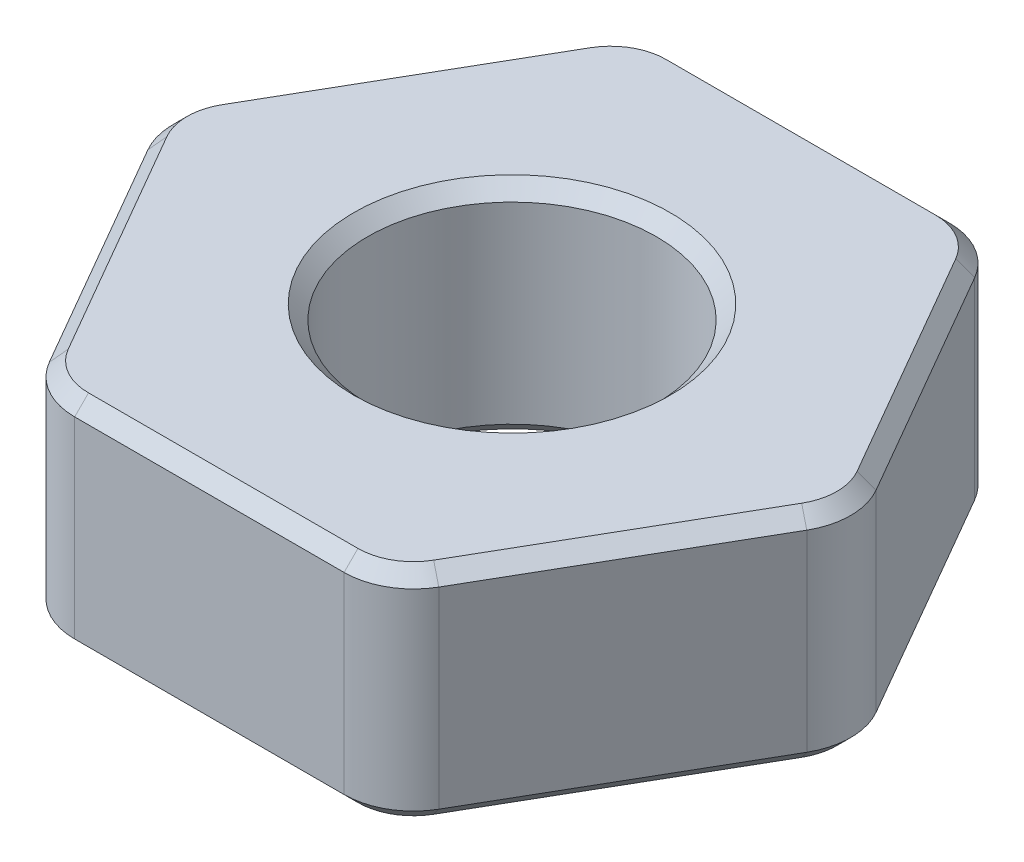
from build123d import *

# Parameters (mm, degrees)
SKETCH1_R           = 2.0828
BOSS_EXTRUDE1_DEPTH = 1.5875
FILLET1_R           = 1
CHAMFER1_SIZE       = 0.2


with BuildPart() as part:
    # Sketch1 → Boss-Extrude1 (new, symmetric)
    with BuildSketch(Plane(origin=(0, 0, 0), x_dir=(1, 0, 0), z_dir=(0, 1, 0))):
        Polygon((2.520494769, 4.365625), (-2.520494769, 4.365625), (-5.040989538, 0), (-2.520494769, -4.365625), (2.520494769, -4.365625), (5.040989538, 0), align=None)
        Circle(SKETCH1_R, mode=Mode.SUBTRACT)
    extrude(amount=BOSS_EXTRUDE1_DEPTH, both=True)

    # Fillet1
    fillet1_edges = [part.edges().sort_by_distance(p)[0] for p in [
        (5.040989538, 0, 0),
        (2.520494769, 0, 4.365625),
        (-5.040989538, 0, 0),
        (-2.520494769, 0, -4.365625),
        (2.520494769, 0, -4.365625),
        (-2.520494769, 0, 4.365625),
    ]]
    fillet(fillet1_edges, radius=FILLET1_R)

    # Chamfer1
    chamfer1_edges = [part.edges().sort_by_distance(p)[0] for p in [
        (-2.0828, -1.5875, 0),
        (2.4431445, -1.5875, -4.231650404),
        (0, -1.5875, -4.365625),
        (-2.4431445, -1.5875, -4.231650404),
        (-3.780742153, -1.5875, -2.1828125),
        (-4.886288999, -1.5875, 0),
        (-3.780742153, -1.5875, 2.1828125),
        (-2.4431445, -1.5875, 4.231650404),
        (0, -1.5875, 4.365625),
        (2.4431445, -1.5875, 4.231650404),
        (3.780742153, -1.5875, 2.1828125),
        (4.886288999, -1.5875, 0),
        (3.780742153, -1.5875, -2.1828125),
        (-2.0828, 1.5875, 0),
        (2.4431445, 1.5875, 4.231650404),
        (0, 1.5875, 4.365625),
        (-2.4431445, 1.5875, 4.231650404),
        (-3.780742153, 1.5875, 2.1828125),
        (-4.886288999, 1.5875, 0),
        (-3.780742153, 1.5875, -2.1828125),
        (-2.4431445, 1.5875, -4.231650404),
        (0, 1.5875, -4.365625),
        (2.4431445, 1.5875, -4.231650404),
        (3.780742153, 1.5875, -2.1828125),
        (4.886288999, 1.5875, 0),
        (3.780742153, 1.5875, 2.1828125),
    ]]
    chamfer(chamfer1_edges, length=CHAMFER1_SIZE)


solid = part.part
